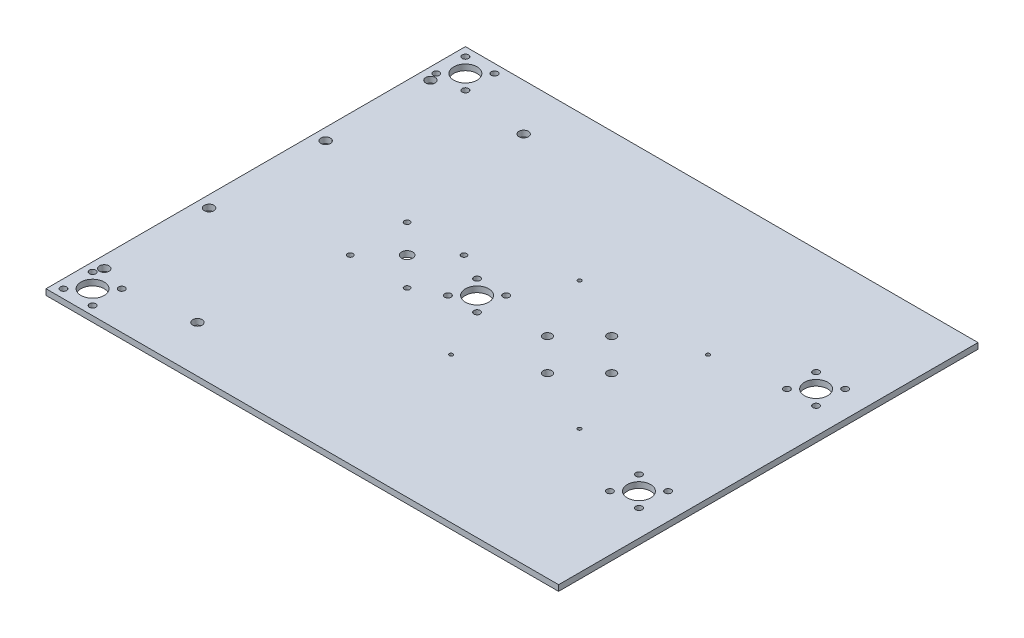
from build123d import *

# Parameters (mm, degrees)
SKETCH1_W               = 279.4
SKETCH1_H               = 228.6
BOSS_EXTRUDE1_DEPTH     = 3.175
SKETCH3_R               = 2.600000007
CUT_EXTRUDE1_DEPTH      = 181.528835993
SKETCH5_R               = 1.5
SKETCH5_R_2             = 3.007999953
CUT_EXTRUDE2_DEPTH      = 181.528835993
SKETCH7_R               = 0.999998
CUT_EXTRUDE3_DEPTH      = 181.528835993
SKETCH8_R               = 2.35
CUT_EXTRUDE4_DEPTH      = 181.528835993
CUT_EXTRUDE5_DEPTH      = 181.528835993
CUT_EXTRUDE5_DEPTH_BACK = 181.528835993
SKETCH9_R               = 1.726999975
SKETCH9_R_2             = 6.35


with BuildPart() as part:
    # Sketch1 → Boss-Extrude1 (new body)
    with BuildSketch(Plane(origin=(0, 0, 0), x_dir=(1, 0, 0), z_dir=(0, 1, 0))):
        Rectangle(SKETCH1_W, SKETCH1_H)
    extrude(amount=BOSS_EXTRUDE1_DEPTH)

    # Sketch3 → Cut-Extrude1 (cut, through all)
    with BuildSketch(Plane(origin=(0, 3.175, 0), x_dir=(1, 0, 0), z_dir=(0, 1, 0))):
        with Locations((-133.35, -31.75)):
            Circle(SKETCH3_R)
        with Locations((-82.55, -88.9)):
            Circle(SKETCH3_R)
        with Locations((-133.35, -88.9)):
            Circle(SKETCH3_R)
    cut_extrude1 = extrude(amount=-CUT_EXTRUDE1_DEPTH, mode=Mode.SUBTRACT)

    # Mirror1: Cut-Extrude1 across plane
    add(cut_extrude1.mirror(Plane.XY), mode=Mode.SUBTRACT)

    # Sketch5 → Cut-Extrude2 (cut, through all)
    with BuildSketch(Plane(origin=(0, 3.175, 0), x_dir=(1, 0, 0), z_dir=(0, 1, 0))):
        with Locations((-41.674, 15.5)):
            Circle(SKETCH5_R)
        with Locations((-41.674, -15.5)):
            Circle(SKETCH5_R)
        with Locations((-72.674, 15.5)):
            Circle(SKETCH5_R)
        with Locations((-72.674, -15.5)):
            Circle(SKETCH5_R)
        with Locations((-57.174, 0)):
            Circle(SKETCH5_R_2)
    extrude(amount=-CUT_EXTRUDE2_DEPTH, mode=Mode.SUBTRACT)

    # Sketch7 → Cut-Extrude3 (cut, through all)
    with BuildSketch(Plane(origin=(0, 3.175, 0), x_dir=(1, 0, 0), z_dir=(0, 1, 0))):
        with Locations((71.831787507, -35.001787507)):
            Circle(SKETCH7_R)
        with Locations((1.828212493, -35.001787507)):
            Circle(SKETCH7_R)
        with Locations((1.828212493, 35.001787507)):
            Circle(SKETCH7_R)
        with Locations((71.831787507, 35.001787507)):
            Circle(SKETCH7_R)
    extrude(amount=-CUT_EXTRUDE3_DEPTH, mode=Mode.SUBTRACT)

    # Sketch8 → Cut-Extrude4 (cut, through all)
    with BuildSketch(Plane(origin=(0, 3.175, 0), x_dir=(1, 0, 0), z_dir=(0, 1, 0))):
        with Locations((19.33, 0)):
            Circle(SKETCH8_R)
        with Locations((54.33, 0)):
            Circle(SKETCH8_R)
        with BuildLine():
            ThreePointArc((36.83, -19.85), (39.18, -17.5), (36.83, -15.15))
            ThreePointArc((36.83, -15.15), (34.48, -17.5), (36.83, -19.85))
        make_face()
        with BuildLine():
            ThreePointArc((36.83, 15.15), (39.18, 17.5), (36.83, 19.85))
            ThreePointArc((36.83, 19.85), (34.48, 17.5), (36.83, 15.15))
        make_face()
    extrude(amount=-CUT_EXTRUDE4_DEPTH, mode=Mode.SUBTRACT)

    # Sketch9 → Cut-Extrude5 (cut, two sides: drawn at the far end of the back side and taken through both)
    with BuildSketch(Plane(origin=(0, 3.175, 0), x_dir=(1, 0, 0), z_dir=(0, 1, 0)).offset(-CUT_EXTRUDE5_DEPTH_BACK)):
        with Locations((-119.0625, -109.5375)):
            Circle(SKETCH9_R)
        with Locations((-119.0625, -93.6625)):
            Circle(SKETCH9_R)
        with Locations((-134.9375, -93.6625)):
            Circle(SKETCH9_R)
        with Locations((-134.9375, -109.5375)):
            Circle(SKETCH9_R)
        with Locations((-127, -101.6)):
            Circle(SKETCH9_R_2)
        with Locations((125.4125, -56.1975)):
            Circle(SKETCH9_R)
        with Locations((125.4125, -40.3225)):
            Circle(SKETCH9_R)
        with Locations((117.475, -48.26)):
            Circle(SKETCH9_R_2)
        with Locations((109.5375, -40.3225)):
            Circle(SKETCH9_R)
        with Locations((109.5375, -56.1975)):
            Circle(SKETCH9_R)
        with Locations((-11.1125, 7.9375)):
            Circle(SKETCH9_R)
        with Locations((-11.1125, -7.9375)):
            Circle(SKETCH9_R)
        with Locations((-19.05, 0)):
            Circle(SKETCH9_R_2)
        with Locations((-26.9875, -7.9375)):
            Circle(SKETCH9_R)
        with Locations((-26.9875, 7.9375)):
            Circle(SKETCH9_R)
        with Locations((109.5375, 56.1975)):
            Circle(SKETCH9_R)
        with Locations((109.5375, 40.3225)):
            Circle(SKETCH9_R)
        with Locations((125.4125, 56.1975)):
            Circle(SKETCH9_R)
        with Locations((117.475, 48.26)):
            Circle(SKETCH9_R_2)
        with Locations((125.4125, 40.3225)):
            Circle(SKETCH9_R)
        with Locations((-119.0625, 93.6625)):
            Circle(SKETCH9_R)
        with Locations((-119.0625, 109.5375)):
            Circle(SKETCH9_R)
        with Locations((-134.9375, 109.5375)):
            Circle(SKETCH9_R)
        with Locations((-134.9375, 93.6625)):
            Circle(SKETCH9_R)
        with Locations((-127, 101.6)):
            Circle(SKETCH9_R_2)
    extrude(amount=CUT_EXTRUDE5_DEPTH + CUT_EXTRUDE5_DEPTH_BACK, mode=Mode.SUBTRACT)


solid = part.part
